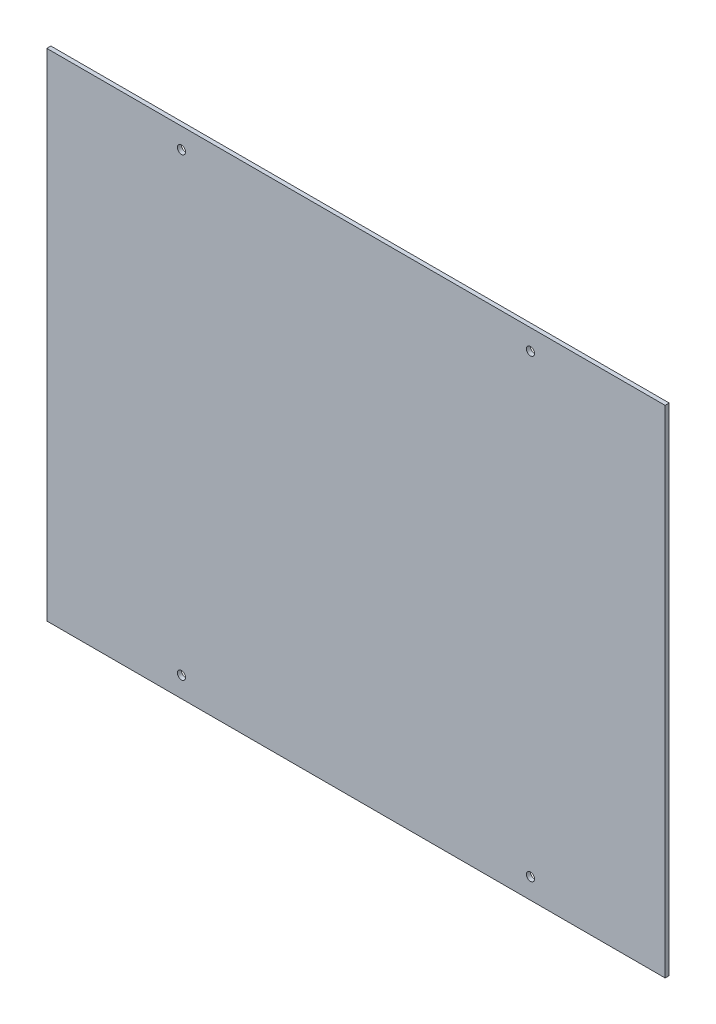
from build123d import *

# Parameters (mm, degrees)
SKETCH1_W           = 303
SKETCH1_H           = 243
SKETCH1_R           = 2
BOSS_EXTRUDE1_DEPTH = 2


with BuildPart() as part:
    # Sketch1 → Boss-Extrude1 (new body)
    with BuildSketch(Plane.XY):
        Rectangle(SKETCH1_W, SKETCH1_H)
        with Locations((-85.5, 111.5)):
            Circle(SKETCH1_R, mode=Mode.SUBTRACT)
        with Locations((85.5, 111.5)):
            Circle(SKETCH1_R, mode=Mode.SUBTRACT)
        with Locations((85.5, -111.5)):
            Circle(SKETCH1_R, mode=Mode.SUBTRACT)
        with Locations((-85.5, -111.5)):
            Circle(SKETCH1_R, mode=Mode.SUBTRACT)
    extrude(amount=BOSS_EXTRUDE1_DEPTH)


solid = part.part
